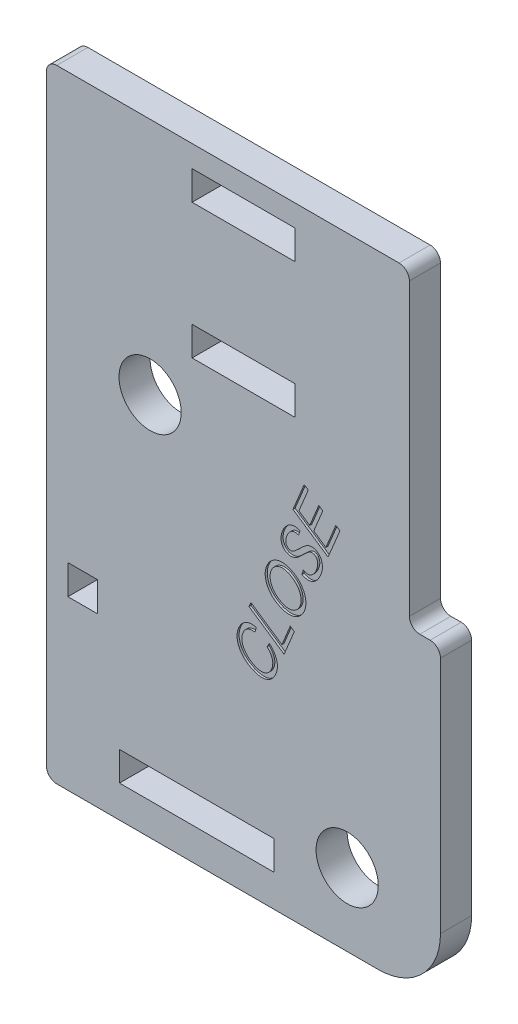
from build123d import *

# Parameters (mm, degrees)
SKETCH_1_W          = 14.9
SKETCH_1_H          = 2.81
SKETCH_1_W_2        = 2.85
SKETCH_1_H_2        = 2.85
SKETCH_1_R          = 3
SKETCH_1_W_3        = 9.9
EXTRUDE_1_DEPTH     = 3
FILLET_1_R          = 1
FILLET_2_R          = 1
CUT_EXTRUDE_START   = -0.2
CUT_EXTRUDE_2_DEPTH = 0.2


# Read off the part's stored shape, not the designer's step: Вырез-Вытянуть2
with BuildPart() as part:
    # Эскиз1 → Бобышка-Вытянуть1 (new body)
    with BuildSketch(Plane.XY):
        with BuildLine():
            Line((16, 0), (16, 30))
            Line((16, 30), (-19, 30))
            Line((-19, 30), (-19, -30))
            Line((-19, -30), (13, -30))
            ThreePointArc((13, -30), (17.242640687, -28.242640687), (19, -24))
            Line((19, -24), (19, 0))
            Line((19, 0), (16, 0))
        make_face()
        with Locations((-4.5, -25.5)):
            Rectangle(SKETCH_1_W, SKETCH_1_H, mode=Mode.SUBTRACT)
        with Locations((-15.5, -12.405)):
            Rectangle(SKETCH_1_W_2, SKETCH_1_H_2, mode=Mode.SUBTRACT)
        with Locations((10, -23)):
            Circle(SKETCH_1_R, mode=Mode.SUBTRACT)
        with Locations((-9, 7)):
            Circle(SKETCH_1_R, mode=Mode.SUBTRACT)
        with Locations((0, 26.5)):
            Rectangle(SKETCH_1_W_3, SKETCH_1_H, mode=Mode.SUBTRACT)
        with Locations((0, 13.5)):
            Rectangle(SKETCH_1_W_3, SKETCH_1_H, mode=Mode.SUBTRACT)
    extrude(amount=EXTRUDE_1_DEPTH)

    # Скругление1
    fillet_1_edges = [part.edges().sort_by_distance(p)[0] for p in [
        (-19, -30, 1.5),
        (-19, 30, 1.5),
    ]]
    fillet(fillet_1_edges, radius=FILLET_1_R)

    # Скругление2
    fillet_2_edges = [part.edges().sort_by_distance(p)[0] for p in [
        (16, 30, 1.5),
        (16, 0, 1.5),
        (19, 0, 1.5),
    ]]
    fillet(fillet_2_edges, radius=FILLET_2_R)

    # Вырез-Вытянуть2 outline → Вырез-Вытянуть2 (cut)
    # profile 1 of 5: a face of its own
    with BuildSketch(Plane.XY.offset(3).offset(CUT_EXTRUDE_START)):
        with BuildLine():
            add(Edge.make_bspline(
                [(2.726567834, -10.022389069), (2.739752328, -9.988776145), (2.765913789, -9.922079376), (2.79393749, -9.819175527), (2.814578998, -9.715622748), (2.825170635, -9.611273493), (2.829495421, -9.506197296), (2.821735513, -9.400463234), (2.807361437, -9.293871086), (2.783784471, -9.186947191), (2.751866908, -9.081041279), (2.709895064, -8.977799222), (2.660211257, -8.877012895), (2.602126357, -8.778866731), (2.53357939, -8.684939259), (2.457468116, -8.593317314), (2.373094022, -8.50427376), (2.311150999, -8.449022372), (2.279737901, -8.421002795)],
                knots=[0, 0, 0, 0, 0.060714284, 0.120472906, 0.179174374, 0.238193265, 0.296791415, 0.355883841, 0.416314685, 0.477654514, 0.539917633, 0.602208321, 0.664949724, 0.728858538, 0.79383926, 0.860381824, 0.929195586, 1, 1, 1, 1], degree=3))
            add(Edge.make_bspline(
                [(1.14157157, -10.613908896), (1.187067894, -10.631921062), (1.275315824, -10.666858751), (1.408832925, -10.70492771), (1.537360293, -10.732205638), (1.661968451, -10.745341195), (1.78188422, -10.746420104), (1.897474468, -10.735521735), (2.008632601, -10.710307414), (2.114970846, -10.672939799), (2.215528934, -10.62439841), (2.309697327, -10.566344036), (2.396648414, -10.498698338), (2.477507619, -10.422317582), (2.550339981, -10.335658246), (2.616757925, -10.240097756), (2.677046267, -10.135627256), (2.709849723, -10.060617434), (2.726567834, -10.022389069)],
                knots=[0, 0, 0, 0, 0.076554033, 0.148489689, 0.217040796, 0.281997701, 0.344265634, 0.404497196, 0.463308754, 0.522231671, 0.580564211, 0.637771083, 0.695075656, 0.752725426, 0.811565215, 0.871925791, 0.934727647, 1, 1, 1, 1], degree=3))
            add(Edge.make_bspline(
                [(0.09062116, -9.742338357), (0.12086284, -9.789965945), (0.181247948, -9.885066383), (0.287485359, -10.016374788), (0.401995338, -10.140687784), (0.529443448, -10.253361947), (0.666511203, -10.358260795), (0.814051449, -10.454114288), (0.973116844, -10.540040251), (1.084771181, -10.589001504), (1.14157157, -10.613908896)],
                knots=[0, 0, 0, 0, 0.12176439, 0.243133179, 0.364213698, 0.486456835, 0.610018747, 0.73674803, 0.866079412, 1, 1, 1, 1], degree=3))
            add(Edge.make_bspline(
                [(-0.037645183, -8.387389233), (-0.059285863, -8.443913253), (-0.101897761, -8.555212704), (-0.139070812, -8.727861114), (-0.156587482, -8.899390135), (-0.151221387, -9.070416501), (-0.123554825, -9.240596409), (-0.074791629, -9.410359087), (-0.003584567, -9.5793445), (0.058745395, -9.687187211), (0.09062116, -9.742338357)],
                knots=[0, 0, 0, 0, 0.127953531, 0.251948775, 0.372493221, 0.492183457, 0.613003361, 0.736529836, 0.865260421, 1, 1, 1, 1], degree=3))
            add(Edge.make_bspline(
                [(1.106772898, -7.768622906), (1.072082584, -7.764694188), (1.004450136, -7.757034736), (0.904430624, -7.754646301), (0.808992028, -7.756943537), (0.717923791, -7.76639309), (0.631242261, -7.781589704), (0.549116125, -7.803872962), (0.471295497, -7.833066487), (0.397636453, -7.868372298), (0.328143768, -7.910185127), (0.262601618, -7.957867117), (0.202538844, -8.013677864), (0.145512565, -8.075165817), (0.093049068, -8.143787203), (0.044635994, -8.218847539), (0.00035491, -8.300259735), (-0.02482032, -8.357983412), (-0.037645183, -8.387389233)],
                knots=[0, 0, 0, 0, 0.073836991, 0.143953048, 0.211493578, 0.275722994, 0.337490922, 0.397517523, 0.455497896, 0.513132939, 0.570101885, 0.62689957, 0.684293038, 0.743297275, 0.804166665, 0.8667973, 0.932143362, 1, 1, 1, 1], degree=3))
            Line((1.106772898, -7.768622906), (1.236017583, -7.322592176))
            add(Edge.make_bspline(
                [(-0.464357759, -8.211506398), (-0.443628692, -8.164550929), (-0.403156531, -8.072873414), (-0.333211712, -7.943068671), (-0.255215317, -7.825044457), (-0.172054783, -7.716567378), (-0.080454609, -7.620184499), (0.017729368, -7.534794196), (0.121773584, -7.45883746), (0.233149154, -7.396371042), (0.348505082, -7.343775777), (0.467550741, -7.303929081), (0.589385229, -7.275299799), (0.713909452, -7.260402103), (0.840974284, -7.256977246), (0.970696983, -7.266771467), (1.103376663, -7.287344667), (1.191342066, -7.310720269), (1.236017583, -7.322592176)],
                knots=[0, 0, 0, 0, 0.072432017, 0.141418826, 0.207815726, 0.271928941, 0.334101882, 0.39513508, 0.455398442, 0.515576839, 0.575053234, 0.634102735, 0.692478055, 0.751397438, 0.810805687, 0.871606738, 0.934792143, 1, 1, 1, 1], degree=3))
            add(Edge.make_bspline(
                [(-0.43182765, -9.766175474), (-0.459584463, -9.70259776), (-0.514185402, -9.577532865), (-0.570886463, -9.383121395), (-0.607532978, -9.188594519), (-0.622590984, -8.993400076), (-0.615815564, -8.797484094), (-0.586984376, -8.601440471), (-0.538690227, -8.404115889), (-0.489409328, -8.276419756), (-0.464357759, -8.211506398)],
                knots=[0, 0, 0, 0, 0.129716589, 0.255167898, 0.378005844, 0.499614178, 0.620774819, 0.744069568, 0.869899712, 1, 1, 1, 1], degree=3))
            add(Edge.make_bspline(
                [(0.959766431, -11.038168373), (0.91917258, -11.020967027), (0.838653685, -10.986847739), (0.722330823, -10.929105102), (0.609250833, -10.870021223), (0.501597999, -10.805955214), (0.398025329, -10.739180827), (0.299977362, -10.667979875), (0.206276867, -10.593307479), (0.116561472, -10.515940709), (0.031885995, -10.434353606), (-0.048824202, -10.350196898), (-0.123949369, -10.26130284), (-0.195187528, -10.169544615), (-0.261978141, -10.074271438), (-0.322944588, -9.974729846), (-0.380611076, -9.872417217), (-0.414726001, -9.801650494), (-0.43182765, -9.766175474)],
                knots=[0, 0, 0, 0, 0.068463333, 0.135798693, 0.201641416, 0.266589317, 0.330301174, 0.39299046, 0.454705786, 0.516365312, 0.576919348, 0.637281227, 0.697395963, 0.757600817, 0.817674026, 0.878005959, 0.93884497, 1, 1, 1, 1], degree=3))
            add(Edge.make_bspline(
                [(3.139481728, -10.231584867), (3.115528629, -10.285615626), (3.068780461, -10.391064982), (2.985705443, -10.539022652), (2.893524639, -10.67302377), (2.790596711, -10.791916762), (2.679850993, -10.897948295), (2.560085016, -10.990648451), (2.429782246, -11.067424856), (2.291682201, -11.131027238), (2.145782523, -11.179366148), (1.99314204, -11.210347635), (1.834594272, -11.223630115), (1.670183266, -11.220888693), (1.500156934, -11.200158307), (1.324132055, -11.163744277), (1.142337045, -11.110225909), (1.021683926, -11.062606161), (0.959766431, -11.038168373)],
                knots=[0, 0, 0, 0, 0.067191204, 0.131133995, 0.192684663, 0.251860352, 0.309662582, 0.366822634, 0.42369053, 0.481298455, 0.539454828, 0.598096326, 0.658015885, 0.720068272, 0.784787843, 0.852528236, 0.924319551, 1, 1, 1, 1], degree=3))
            add(Edge.make_bspline(
                [(2.503739461, -8.014221648), (2.548801791, -8.056172717), (2.637005432, -8.138286471), (2.758607221, -8.267813217), (2.866570402, -8.40025469), (2.963056704, -8.534429688), (3.044788658, -8.672161721), (3.115302562, -8.811613003), (3.173143598, -8.953635483), (3.21745673, -9.097942862), (3.249032751, -9.242816919), (3.269768837, -9.387143718), (3.277919962, -9.530480807), (3.275315347, -9.673222181), (3.258288314, -9.814616777), (3.232039038, -9.955407217), (3.192575803, -10.094984901), (3.157305769, -10.185727332), (3.139481728, -10.231584867)],
                knots=[0, 0, 0, 0, 0.074708193, 0.146231558, 0.21541212, 0.281969862, 0.346608527, 0.409581351, 0.471471911, 0.532484388, 0.592555252, 0.651263707, 0.709256316, 0.766625878, 0.824288674, 0.881887652, 0.940310821, 1, 1, 1, 1], degree=3))
            Line((2.503739461, -8.014221648), (2.279737901, -8.421002795))
        make_face()
    # profile 2 of 5: a face of its own
    with BuildSketch(Plane.XY.offset(3).offset(CUT_EXTRUDE_START)):
        with BuildLine():
            add(Edge.make_bspline(
                [(7.450496452, 0.176125347), (7.428879503, 0.126357188), (7.386639911, 0.029110037), (7.314279151, -0.10889031), (7.237538299, -0.237232848), (7.153842689, -0.354176812), (7.066729083, -0.462311956), (6.971627712, -0.557461244), (6.872926241, -0.643940662), (6.768264611, -0.719409777), (6.655998539, -0.78078232), (6.534807144, -0.824716456), (6.40511239, -0.850297754), (6.267318303, -0.857135039), (6.121513211, -0.847197068), (5.96758699, -0.819341398), (5.805265533, -0.773657058), (5.696700176, -0.73163102), (5.640339004, -0.709813408)],
                knots=[0, 0, 0, 0, 0.07031675, 0.137399166, 0.201840137, 0.26399421, 0.323688675, 0.381618953, 0.4381362, 0.493664843, 0.548550736, 0.603446457, 0.660103525, 0.719260377, 0.78177984, 0.849152916, 0.921688477, 1, 1, 1, 1], degree=3))
            add(Edge.make_bspline(
                [(6.955142771, 2.020507286), (6.979582538, 2.009657992), (7.027861761, 1.988225894), (7.097022728, 1.949901655), (7.161847892, 1.906417244), (7.223796625, 1.858462813), (7.28039634, 1.803943936), (7.335146025, 1.746085295), (7.385283105, 1.682478602), (7.431020412, 1.614257161), (7.472799633, 1.542252455), (7.508708357, 1.466703069), (7.539814934, 1.388634489), (7.56605132, 1.30802948), (7.585836621, 1.224227111), (7.599883958, 1.137465939), (7.610155425, 1.048136977), (7.615799125, 0.924725189), (7.608964532, 0.765749247), (7.578737381, 0.571789227), (7.526196623, 0.373438084), (7.476176081, 0.243059381), (7.450496452, 0.176125347)],
                knots=[0, 0, 0, 0, 0.037666167, 0.074407145, 0.111238611, 0.147582273, 0.184628479, 0.221850153, 0.259758102, 0.29858897, 0.337507287, 0.376951612, 0.416342034, 0.455858115, 0.49628493, 0.537535505, 0.579647559, 0.622915946, 0.711502333, 0.803332029, 0.899034272, 1, 1, 1, 1], degree=3))
            add(Edge.make_bspline(
                [(6.029527728, 1.906945864), (6.065494009, 1.930321463), (6.136056055, 1.97618192), (6.248959752, 2.028430681), (6.363487579, 2.067146795), (6.480311468, 2.090259176), (6.59863094, 2.098051143), (6.717903703, 2.089789635), (6.838105974, 2.064946633), (6.915576467, 2.035530772), (6.955142771, 2.020507286)],
                knots=[0, 0, 0, 0, 0.131839266, 0.258654722, 0.381578631, 0.503065624, 0.623984241, 0.745348868, 0.869942689, 1, 1, 1, 1], degree=3))
            add(Edge.make_bspline(
                [(5.523242624, 1.463578035), (5.550944276, 1.489975921), (5.604266525, 1.540788581), (5.681039742, 1.613937434), (5.752495507, 1.679784195), (5.818616997, 1.73847187), (5.878886854, 1.790611574), (5.934127168, 1.835600635), (5.983447051, 1.873955234), (6.015000221, 1.896545157), (6.029527728, 1.906945864)],
                knots=[0, 0, 0, 0, 0.170425255, 0.328047506, 0.472280896, 0.603161342, 0.72179737, 0.827180688, 0.920431649, 1, 1, 1, 1], degree=3))
            add(Edge.make_bspline(
                [(4.974449173, 0.951087594), (4.986532556, 0.961401612), (5.014060428, 0.984898588), (5.060125916, 1.02441928), (5.114359004, 1.074715789), (5.179062851, 1.133258837), (5.251202833, 1.203300276), (5.334548621, 1.280507496), (5.425285897, 1.369226136), (5.489470526, 1.431048757), (5.523242624, 1.463578035)],
                knots=[0, 0, 0, 0, 0.063461865, 0.144576243, 0.242419729, 0.358890617, 0.493111317, 0.644016167, 0.812691588, 1, 1, 1, 1], degree=3))
            add(Edge.make_bspline(
                [(4.396043557, 0.804721903), (4.417920471, 0.796606581), (4.460857921, 0.780678775), (4.528280941, 0.769072002), (4.595688186, 0.767249963), (4.664577693, 0.775964313), (4.736190187, 0.798709193), (4.811814808, 0.835894495), (4.892946135, 0.887006831), (4.946201396, 0.928878126), (4.974449173, 0.951087594)],
                knots=[0, 0, 0, 0, 0.110645855, 0.217162748, 0.32319492, 0.430051316, 0.545391515, 0.678365231, 0.82939775, 1, 1, 1, 1], degree=3))
            add(Edge.make_bspline(
                [(4.110237555, 1.126055163), (4.115719932, 1.107491772), (4.126457937, 1.071132766), (4.150828516, 1.020373443), (4.17808059, 0.972662794), (4.213098961, 0.931066254), (4.250729432, 0.891978667), (4.294828653, 0.858568805), (4.343192608, 0.828697747), (4.378243935, 0.812796705), (4.396043557, 0.804721903)],
                knots=[0, 0, 0, 0, 0.129878771, 0.254385794, 0.377539439, 0.498034351, 0.618729698, 0.741542669, 0.868751253, 1, 1, 1, 1], degree=3))
            add(Edge.make_bspline(
                [(4.195790287, 1.833028096), (4.182698028, 1.799694439), (4.157253815, 1.734911987), (4.126465301, 1.63807405), (4.104317718, 1.544424091), (4.08928934, 1.454335041), (4.081790661, 1.36731791), (4.082586356, 1.283536109), (4.091485977, 1.202933669), (4.10405185, 1.151415576), (4.110237555, 1.126055163)],
                knots=[0, 0, 0, 0, 0.148134868, 0.28789341, 0.4199619, 0.545935822, 0.665448753, 0.780797416, 0.892094841, 1, 1, 1, 1], degree=3))
            add(Edge.make_bspline(
                [(5.051648559, 2.498466488), (5.022980189, 2.499772643), (4.966471592, 2.502347221), (4.88301843, 2.493940818), (4.802942261, 2.476032995), (4.7249426, 2.450082726), (4.649608002, 2.411178225), (4.574874071, 2.362036982), (4.502357666, 2.299030698), (4.431472242, 2.2250411), (4.363450448, 2.140719966), (4.30168834, 2.046296197), (4.243586672, 1.944030309), (4.211972186, 1.8706089), (4.195790287, 1.833028096)],
                knots=[0, 0, 0, 0, 0.073908007, 0.145681034, 0.215403362, 0.285166479, 0.356939507, 0.433330146, 0.515243614, 0.603983352, 0.697242925, 0.79406685, 0.894592961, 1, 1, 1, 1], degree=3))
            add(Edge.make_bspline(
                [(5.308336136, 2.425100468), (5.283570653, 2.435144594), (5.23670024, 2.454153808), (5.168786422, 2.476189159), (5.108031618, 2.491915757), (5.069491859, 2.496393407), (5.051648559, 2.498466488)],
                knots=[0, 0, 0, 0, 0.299093368, 0.566055156, 0.799090386, 1, 1, 1, 1], degree=3))
            Line((5.308336136, 2.425100468), (5.446464278, 2.867451549))
            Line((5.446464278, 2.867451549), (5.369474317, 2.899341835))
            add(Edge.make_bspline(
                [(3.776743646, 2.027418132), (3.791897994, 2.063079378), (3.821509825, 2.132762001), (3.871980494, 2.232223958), (3.924261583, 2.326170397), (3.980467667, 2.413448247), (4.039208975, 2.494964331), (4.101502245, 2.569561809), (4.166211502, 2.638675986), (4.234632716, 2.70037612), (4.30446293, 2.756281788), (4.375410507, 2.806346023), (4.447943375, 2.849139339), (4.521304378, 2.885768681), (4.595670188, 2.916222809), (4.671371698, 2.93940252), (4.747994025, 2.956565374), (4.849694538, 2.969876923), (4.973139123, 2.97530974), (5.114840762, 2.966716453), (5.247623086, 2.944398547), (5.329470943, 2.914133811), (5.369474317, 2.899341835)],
                knots=[0, 0, 0, 0, 0.057175625, 0.111722055, 0.16453273, 0.215802376, 0.264855144, 0.312737492, 0.35915633, 0.404479099, 0.448590632, 0.491132811, 0.532526992, 0.572765527, 0.612072086, 0.650989225, 0.689486777, 0.727824533, 0.802250575, 0.871443326, 0.937167557, 1, 1, 1, 1], degree=3))
            add(Edge.make_bspline(
                [(4.236447061, 0.371263305), (4.191170008, 0.392183527), (4.101932202, 0.433415776), (3.981324863, 0.517366637), (3.875648708, 0.617055723), (3.800743784, 0.712880259), (3.749093875, 0.795948097), (3.715458552, 0.862056603), (3.68787158, 0.931573917), (3.66344595, 1.003398495), (3.646661478, 1.078824996), (3.632888063, 1.156600849), (3.626429216, 1.237562548), (3.622442436, 1.349936299), (3.631375011, 1.494607058), (3.660038384, 1.67065835), (3.707940698, 1.849909367), (3.7534474, 1.967314781), (3.776743646, 2.027418132)],
                knots=[0, 0, 0, 0, 0.077404744, 0.152559169, 0.227192381, 0.302475115, 0.340841495, 0.379115677, 0.417571792, 0.457016817, 0.496879077, 0.537539668, 0.579690362, 0.622980714, 0.712260333, 0.804396563, 0.899864735, 1, 1, 1, 1], degree=3))
            add(Edge.make_bspline(
                [(5.233008034, 0.543035407), (5.189442623, 0.5134427), (5.105712983, 0.45656761), (4.974658805, 0.391450632), (4.849142355, 0.339674394), (4.72462186, 0.309603565), (4.601897806, 0.29667994), (4.479307139, 0.303044179), (4.356049875, 0.32619824), (4.276830486, 0.356047261), (4.236447061, 0.371263305)],
                knots=[0, 0, 0, 0, 0.148787077, 0.285958239, 0.413115102, 0.532033662, 0.646954344, 0.760940037, 0.878135136, 1, 1, 1, 1], degree=3))
            add(Edge.make_bspline(
                [(5.773215638, 1.034797781), (5.743449736, 1.005141669), (5.686228701, 0.948131691), (5.602046143, 0.867734993), (5.525458401, 0.793667814), (5.453766185, 0.729137548), (5.390283243, 0.670720756), (5.332231473, 0.621321815), (5.281262206, 0.578620654), (5.248237448, 0.554266403), (5.233008034, 0.543035407)],
                knots=[0, 0, 0, 0, 0.172417458, 0.331449901, 0.47768066, 0.609580117, 0.727245632, 0.831652273, 0.922366211, 1, 1, 1, 1], degree=3))
            add(Edge.make_bspline(
                [(6.445515474, 1.583727647), (6.427826128, 1.576014431), (6.388080341, 1.558683783), (6.32644651, 1.520822195), (6.255655427, 1.470959943), (6.17616299, 1.408159194), (6.088087956, 1.332776764), (5.990852799, 1.244843347), (5.884549734, 1.144582557), (5.811474045, 1.072523785), (5.773215638, 1.034797781)],
                knots=[0, 0, 0, 0, 0.066323253, 0.149020197, 0.248175673, 0.364199075, 0.497344295, 0.64694844, 0.815161646, 1, 1, 1, 1], degree=3))
            add(Edge.make_bspline(
                [(6.806650596, 1.582449128), (6.778179633, 1.592428182), (6.721696627, 1.612225439), (6.630931933, 1.619935197), (6.537573635, 1.612646951), (6.476854603, 1.593572573), (6.445515474, 1.583727647)],
                knots=[0, 0, 0, 0, 0.244211865, 0.484487314, 0.733926614, 1, 1, 1, 1], degree=3))
            add(Edge.make_bspline(
                [(7.035129459, 0.379398841), (7.050038498, 0.416899501), (7.079012998, 0.48977897), (7.113629065, 0.598846561), (7.139922136, 0.703337379), (7.157267595, 0.803517534), (7.165481475, 0.899186174), (7.166504133, 0.990705647), (7.15756449, 1.077943483), (7.13914293, 1.160152309), (7.114589955, 1.236590927), (7.086094893, 1.307384225), (7.051010168, 1.370242301), (7.012536548, 1.427086507), (6.968403752, 1.476810897), (6.91950384, 1.519712487), (6.865481043, 1.555648131), (6.826400676, 1.573451715), (6.806650596, 1.582449128)],
                knots=[0, 0, 0, 0, 0.089108205, 0.173174518, 0.252515159, 0.326930839, 0.397454513, 0.464388265, 0.528794299, 0.590653711, 0.650097571, 0.705993248, 0.758875311, 0.808781446, 0.857326713, 0.905269672, 0.952126047, 1, 1, 1, 1], degree=3))
            add(Edge.make_bspline(
                [(5.89032505, -0.319866498), (5.924272637, -0.33238659), (5.99148405, -0.357174598), (6.09637525, -0.377549439), (6.202029044, -0.383288337), (6.308178322, -0.375791012), (6.414410669, -0.34974767), (6.517659365, -0.300832173), (6.618304575, -0.232236469), (6.714319405, -0.142721499), (6.805872816, -0.036074825), (6.890483115, 0.087664777), (6.968171749, 0.227092582), (7.012315087, 0.327503821), (7.035129459, 0.379398841)],
                knots=[0, 0, 0, 0, 0.071522973, 0.141605355, 0.21048519, 0.280463823, 0.351512467, 0.425584323, 0.505343866, 0.591665495, 0.684610581, 0.783004694, 0.887851443, 1, 1, 1, 1], degree=3))
            Line((5.89032505, -0.319866498), (5.769583689, -0.263782679))
            Line((5.769583689, -0.263782679), (5.640339004, -0.709813408))
        make_face()
    # profile 3 of 5: a face of its own
    with BuildSketch(Plane.XY.offset(3).offset(CUT_EXTRUDE_START)):
        with BuildLine():
            add(Edge.make_bspline(
                [(5.873767118, -3.630435996), (5.858417994, -3.666322058), (5.828073519, -3.737267069), (5.77315678, -3.838123765), (5.714511302, -3.934706007), (5.649913698, -4.025964228), (5.579267502, -4.111471079), (5.504334182, -4.193032635), (5.422213191, -4.267977678), (5.336401199, -4.339241838), (5.244900771, -4.402075076), (5.151032561, -4.4595022), (5.053631842, -4.508118651), (4.953233486, -4.549704486), (4.850345478, -4.584080868), (4.743851138, -4.60977829), (4.635042456, -4.628754736), (4.52368945, -4.639820268), (4.411310398, -4.643116126), (4.299123754, -4.640863565), (4.187772006, -4.632238082), (4.077382689, -4.617024866), (3.96799861, -4.59504053), (3.859396678, -4.566318037), (3.75151411, -4.532594423), (3.681069302, -4.504712635), (3.645779002, -4.490744868)],
                knots=[0, 0, 0, 0, 0.043739822, 0.086471516, 0.128616767, 0.170390103, 0.211696008, 0.25291606, 0.294455798, 0.336259181, 0.377878727, 0.418788651, 0.459554729, 0.499789342, 0.54055542, 0.581046671, 0.622505367, 0.66430875, 0.706393309, 0.748492783, 0.79006813, 0.831544128, 0.873361454, 0.915078932, 0.957457618, 1, 1, 1, 1], degree=3))
            add(Edge.make_bspline(
                [(6.020445907, -2.767516304), (6.0221459, -2.80442994), (6.025542192, -2.878177024), (6.021432695, -2.988471981), (6.013223958, -3.097962131), (5.997466093, -3.206299793), (5.976652535, -3.313950655), (5.948840546, -3.420618269), (5.91467307, -3.526373829), (5.887455192, -3.595614398), (5.873767118, -3.630435996)],
                knots=[0, 0, 0, 0, 0.125524858, 0.250777039, 0.374779807, 0.498503214, 0.622575723, 0.747217984, 0.872874041, 1, 1, 1, 1], degree=3))
            add(Edge.make_bspline(
                [(5.431849577, -1.430911903), (5.475917181, -1.481610715), (5.562837441, -1.581610568), (5.676402739, -1.742602791), (5.774569249, -1.908912251), (5.855539902, -2.080193009), (5.921157077, -2.253169808), (5.971166873, -2.425439239), (6.006267414, -2.596661454), (6.015747749, -2.710902165), (6.020445907, -2.767516304)],
                knots=[0, 0, 0, 0, 0.135347684, 0.266963825, 0.396515149, 0.52422727, 0.648406986, 0.769078234, 0.885562364, 1, 1, 1, 1], degree=3))
            add(Edge.make_bspline(
                [(4.528354726, -0.804287363), (4.572189631, -0.823431445), (4.659225342, -0.861442679), (4.785652365, -0.924795), (4.90639726, -0.995181529), (5.022249169, -1.070677669), (5.132808456, -1.151999754), (5.237759184, -1.239357216), (5.338352484, -1.331466182), (5.400705545, -1.397786373), (5.431849577, -1.430911903)],
                knots=[0, 0, 0, 0, 0.129450941, 0.257029292, 0.382476162, 0.507528738, 0.63113749, 0.753699654, 0.876978195, 1, 1, 1, 1], degree=3))
            add(Edge.make_bspline(
                [(2.249996202, -1.658476253), (2.274012759, -1.603574031), (2.321164757, -1.495783834), (2.409379885, -1.346288423), (2.506261875, -1.209333172), (2.614509257, -1.086579517), (2.733917467, -0.978271196), (2.862999241, -0.882083763), (3.004297806, -0.801782458), (3.153981522, -0.733647439), (3.311689306, -0.682266368), (3.474244761, -0.646289079), (3.641097087, -0.629915846), (3.811744323, -0.628362326), (3.986170026, -0.646680051), (4.164413887, -0.681575642), (4.346712663, -0.733260369), (4.466844148, -0.780235052), (4.528354726, -0.804287363)],
                knots=[0, 0, 0, 0, 0.065570123, 0.128734617, 0.189680255, 0.249063197, 0.307550514, 0.365938283, 0.42496649, 0.485179913, 0.545742542, 0.606269846, 0.667125581, 0.728998326, 0.792845132, 0.858811338, 0.927707577, 1, 1, 1, 1], degree=3))
            add(Edge.make_bspline(
                [(3.645779002, -4.490744868), (3.56671638, -4.455990298), (3.412072912, -4.388011689), (3.194389035, -4.26735462), (2.99610217, -4.133176545), (2.816260105, -3.986751127), (2.655130301, -3.828009242), (2.513520311, -3.656081651), (2.391260355, -3.470926655), (2.289033131, -3.274901637), (2.207016095, -3.072894927), (2.14650069, -2.869148911), (2.107341807, -2.665875888), (2.091306102, -2.462740806), (2.096457109, -2.260058139), (2.124778062, -2.057688071), (2.174846638, -1.855649241), (2.22473966, -1.724742877), (2.249996202, -1.658476253)],
                knots=[0, 0, 0, 0, 0.073381061, 0.14353055, 0.211208139, 0.276640259, 0.340384983, 0.403151919, 0.465615933, 0.528635691, 0.590764205, 0.650650478, 0.709022185, 0.76638922, 0.823519921, 0.881008569, 0.939764881, 1, 1, 1, 1], degree=3))
        make_face()
        with BuildLine():
            add(Edge.make_bspline(
                [(2.679775151, -1.826956206), (2.660817942, -1.876457826), (2.62326362, -1.974520767), (2.588100569, -2.127402542), (2.56825867, -2.281855046), (2.566209795, -2.438326938), (2.581553711, -2.59658051), (2.612413261, -2.756634209), (2.662419192, -2.918210979), (2.727352021, -3.080323913), (2.809161396, -3.238607695), (2.907717152, -3.388844327), (3.022901511, -3.528606656), (3.154996322, -3.6579927), (3.302451249, -3.778315024), (3.466913766, -3.887573476), (3.647519278, -3.986806124), (3.775827148, -4.043319768), (3.841649615, -4.072311501)],
                knots=[0, 0, 0, 0, 0.056367129, 0.111663549, 0.16649901, 0.221883074, 0.277844317, 0.335488418, 0.395082478, 0.457610277, 0.521171557, 0.584416641, 0.648522467, 0.713569037, 0.7809433, 0.850810297, 0.923465067, 1, 1, 1, 1], degree=3))
            add(Edge.make_bspline(
                [(4.316938063, -1.216281345), (4.272560957, -1.199049483), (4.186036665, -1.165451651), (4.054418906, -1.128885301), (3.925922909, -1.103513807), (3.79987541, -1.092342473), (3.676593209, -1.093639834), (3.556056604, -1.107876115), (3.438210639, -1.135198623), (3.324344053, -1.174406011), (3.21601602, -1.224877399), (3.115016935, -1.284711372), (3.021026526, -1.352110624), (2.935819721, -1.429441677), (2.85930542, -1.516286195), (2.790219752, -1.611309961), (2.729630687, -1.71527519), (2.696568459, -1.789337642), (2.679775151, -1.826956206)],
                knots=[0, 0, 0, 0, 0.072789037, 0.141920472, 0.208674359, 0.27290437, 0.335142194, 0.39697631, 0.458203961, 0.51986096, 0.580881013, 0.640701768, 0.699218849, 0.757525839, 0.816321873, 0.875984725, 0.937008882, 1, 1, 1, 1], degree=3))
            add(Edge.make_bspline(
                [(5.460853224, -3.421240198), (5.479391431, -3.37239937), (5.516250307, -3.27529084), (5.548024777, -3.122525714), (5.565444308, -2.967459093), (5.561876046, -2.80954326), (5.542749013, -2.651248412), (5.50763542, -2.49343852), (5.456326571, -2.337651725), (5.3894571, -2.18341845), (5.305870623, -2.032525653), (5.202884873, -1.88717333), (5.082859464, -1.746993614), (4.945301551, -1.615243221), (4.797566931, -1.493113117), (4.642803118, -1.384510141), (4.483699738, -1.290262449), (4.372209565, -1.240801648), (4.316938063, -1.216281345)],
                knots=[0, 0, 0, 0, 0.056934402, 0.113200703, 0.169741956, 0.22692804, 0.285142093, 0.343531778, 0.403069358, 0.463885609, 0.52675744, 0.59096862, 0.657978027, 0.727862741, 0.798588698, 0.866979447, 0.934054764, 1, 1, 1, 1], degree=3))
            add(Edge.make_bspline(
                [(3.841649615, -4.072311501), (3.894526392, -4.092256793), (3.998449396, -4.131456888), (4.160216114, -4.166675183), (4.322009824, -4.184049939), (4.457311204, -4.180191556), (4.563806693, -4.167231944), (4.64214775, -4.151386718), (4.718671467, -4.130340453), (4.793213383, -4.102874897), (4.866088475, -4.070443518), (4.936795398, -4.031796065), (5.00568952, -3.987281679), (5.093907042, -3.920286267), (5.196651221, -3.828038463), (5.302803389, -3.70339307), (5.393337568, -3.568434925), (5.438281605, -3.470449869), (5.460853224, -3.421240198)],
                knots=[0, 0, 0, 0, 0.086712911, 0.170423892, 0.253503038, 0.336155562, 0.377682975, 0.418194644, 0.458822499, 0.499477278, 0.540111348, 0.581249799, 0.62313243, 0.665986549, 0.751329655, 0.834629378, 0.916948214, 1, 1, 1, 1], degree=3))
        make_face(mode=Mode.SUBTRACT)
    # profile 4 of 5: a face of its own
    with BuildSketch(Plane.XY.offset(3).offset(CUT_EXTRUDE_START)):
        Polygon((8.159285758, 2.021300561), (9.306109506, 4.789978006), (8.91558014, 5.053214835), (7.949059163, 2.719826785), (6.779310888, 3.513979), (7.650774282, 5.617877743), (7.263617926, 5.889257741), (6.388781522, 3.777215829), (5.348289791, 4.48140157), (6.255323118, 6.671173731), (5.857127818, 6.915903357), (4.777764291, 4.310089291), align=None)
    # profile 5 of 5: a face of its own
    with BuildSketch(Plane.XY.offset(3).offset(CUT_EXTRUDE_START)):
        Polygon((3.920330815, -8.212441953), (4.901570385, -5.843520075), (4.51441403, -5.572140077), (3.71010422, -7.513915729), (0.718498844, -5.489844404), (0.538809348, -5.923653223), align=None)
    extrude(amount=CUT_EXTRUDE_2_DEPTH, mode=Mode.SUBTRACT)


solid = part.part
